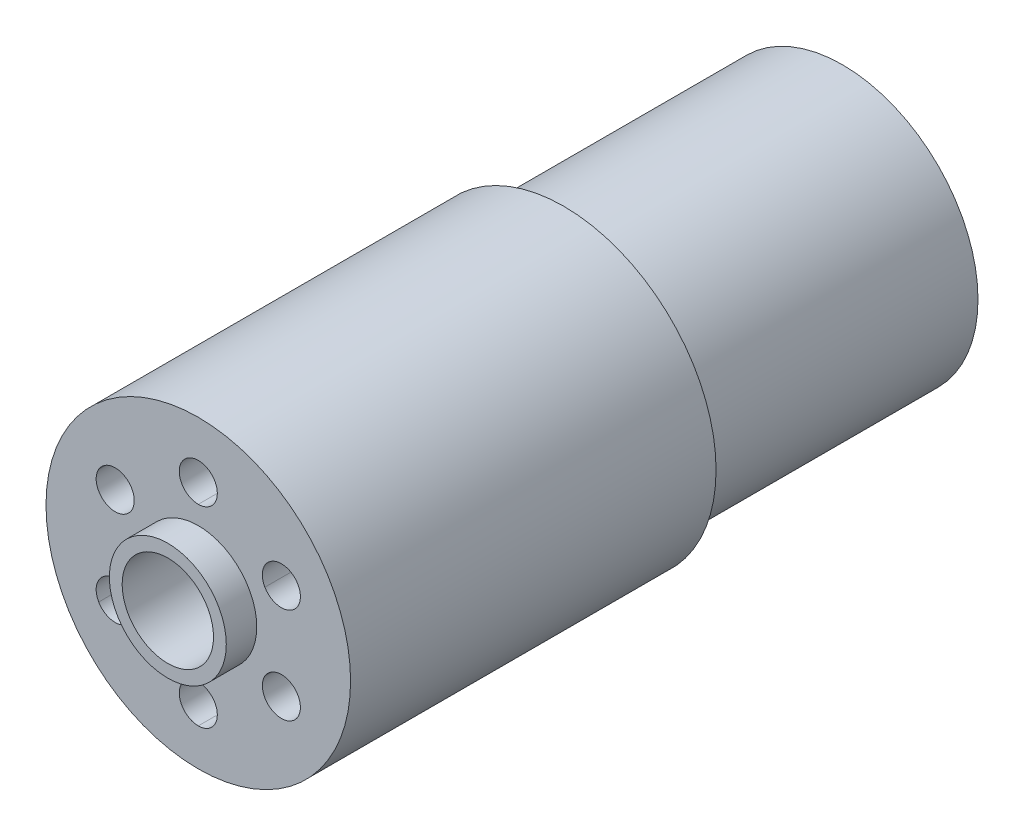
from build123d import *
from build123d.topology import SkipClean

# Parameters (mm, degrees)
SKETCH1_R           = 25.4
BOSS_EXTRUDE2_DEPTH = 107.442
SKETCH6_R           = 7.62
SKETCH6_R_2         = 3.175
CUT_EXTRUDE1_DEPTH  = 108.458
SKETCH7_R           = 25.4
SKETCH7_R_2         = 22.606
CUT_EXTRUDE2_DEPTH  = 46.482
SKETCH8_R           = 9.75
SKETCH8_R_2         = 7.62
BOSS_EXTRUDE7_DEPTH = 5.08
BOSS_EXTRUDE8_START = 5.08
SKETCH9_R           = 9.75
SKETCH9_R_2         = 7.62
BOSS_EXTRUDE8_DEPTH = 5.08


with BuildPart() as part:
    # Sketch1 → Boss-Extrude2 (new body)
    with BuildSketch(Plane.XY):
        Circle(SKETCH1_R)
    extrude(amount=BOSS_EXTRUDE2_DEPTH)

    # Sketch6 → Cut-Extrude1 (cut)
    with BuildSketch(Plane(origin=(0, 0, 0), x_dir=(-1, 0, 0), z_dir=(0, 0, -1))):
        Circle(SKETCH6_R)
        with Locations((-13.858138511, 8.001)):
            Circle(SKETCH6_R_2)
        with Locations((0, 16.002)):
            Circle(SKETCH6_R_2)
        with Locations((13.858138511, 8.001)):
            Circle(SKETCH6_R_2)
        with Locations((13.858138511, -8.001)):
            Circle(SKETCH6_R_2)
        with Locations((0, -16.002)):
            Circle(SKETCH6_R_2)
        with Locations((-13.858138511, -8.001)):
            Circle(SKETCH6_R_2)
    extrude(amount=-CUT_EXTRUDE1_DEPTH, mode=Mode.SUBTRACT)

    # Sketch7 → Cut-Extrude2 (cut)
    with BuildSketch(Plane(origin=(0, 0, 0), x_dir=(-1, 0, 0), z_dir=(0, 0, -1))):
        Circle(SKETCH7_R)
        Circle(SKETCH7_R_2, mode=Mode.SUBTRACT)
    extrude(amount=-CUT_EXTRUDE2_DEPTH, mode=Mode.SUBTRACT)

    # Sketch8 → Boss-Extrude7 (add)
    with SkipClean():  # the faces are left unmerged after this step: merging them gives an invalid solid
        with BuildSketch(Plane.XY.offset(107.442)):
            Circle(SKETCH8_R)
            Circle(SKETCH8_R_2, mode=Mode.SUBTRACT)
        extrude(amount=BOSS_EXTRUDE7_DEPTH)

    # Sketch9 → Boss-Extrude8 (add)
    with SkipClean():  # the faces are left unmerged after this step: merging them gives an invalid solid
        with BuildSketch(Plane(origin=(0, 0, 0), x_dir=(-1, 0, 0), z_dir=(0, 0, -1)).offset(BOSS_EXTRUDE8_START)):
            Circle(SKETCH9_R)
            Circle(SKETCH9_R_2, mode=Mode.SUBTRACT)
        extrude(amount=-BOSS_EXTRUDE8_DEPTH)


solid = part.part
